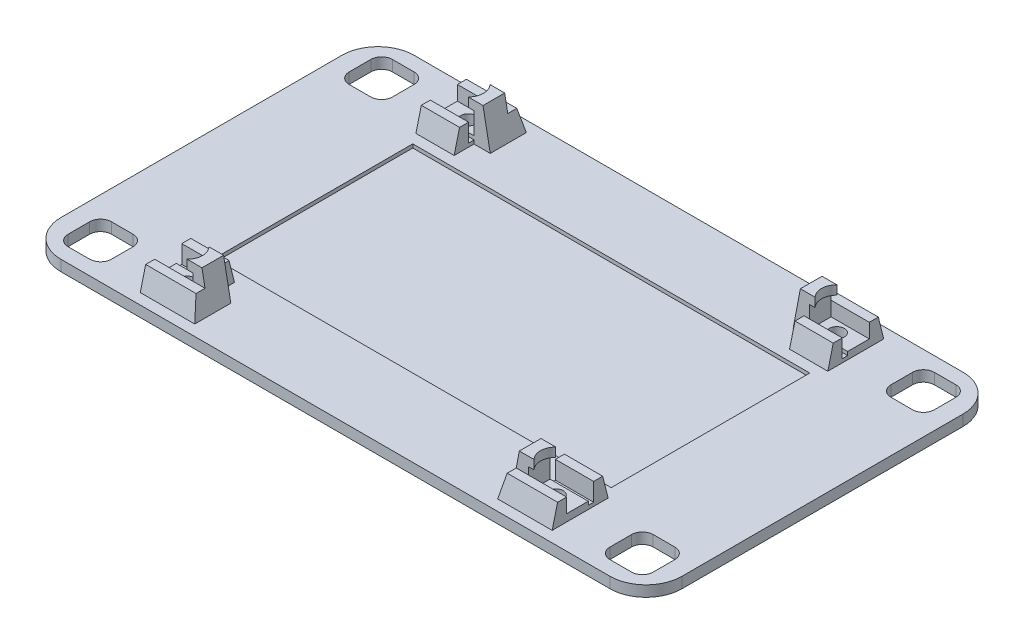
from build123d import *

# Parameters (mm, degrees)
SKETCH1_W                        = 34.5
SKETCH1_H                        = 8.741142107
BOSS_EXTRUDE3_DEPTH              = 3
SKETCH6_W                        = 11
SKETCH6_H                        = 11
BOSS_EXTRUDE4_DEPTH              = 2
CUT_EXTRUDE1_START               = -3
CUT_EXTRUDE1_DEPTH               = 24
SKETCH7_W                        = 11
SKETCH7_H                        = 2.5
SKETCH7_H_2                      = 1
BOSS_EXTRUDE5_DEPTH              = 4
SKETCH10_W                       = 3.083691557
SKETCH10_H                       = 13.597950321
CUT_EXTRUDE2_DEPTH               = 12
SKETCH11_W                       = 10.179154034
SKETCH11_H                       = 1.5
BOSS_EXTRUDE7_DEPTH              = 6
SKETCH12_W                       = 2.5
SKETCH12_H                       = 12.5
BOSS_EXTRUDE8_DEPTH              = 6
BOSS_EXTRUDE9_DEPTH              = 11.6
SKETCH21_R                       = 4
CUT_EXTRUDE9_DEPTH               = 2
CUT_EXTRUDE11_DEPTH              = 11.5
BOSS_EXTRUDE14_DEPTH             = 3
CUT_EXTRUDE12_START              = -1
SKETCH28_W                       = 13.111544153
SKETCH28_H                       = 1.5
CUT_EXTRUDE12_DEPTH              = 11
BOSS_EXTRUDE15_DEPTH             = 1.5
SKETCH30_W                       = 2.5
SKETCH30_H                       = 6
BOSS_EXTRUDE16_DEPTH             = 2
SKETCH31_W                       = 2.5
SKETCH31_H                       = 6
BOSS_EXTRUDE17_DEPTH             = 2.5
BOSS_EXTRUDE18_REACH             = 127.693
BOSS_EXTRUDE18_DIRECTION_2_REACH = 127.693
SKETCH34_W                       = 17.603907028
SKETCH34_H                       = 5.411961877
SKETCH34_H_2                     = 6.558600434
CUT_EXTRUDE13_DEPTH              = 4.5
BOSS_EXTRUDE20_DEPTH             = 11.6
MIRROR11_OUTLINE_R               = 2.069860115
MIRROR11_DEPTH                   = 3
MIRROR11_2_OUTLINE_R             = 4
MIRROR11_2_OUTLINE_R_2           = 2.069860115
MIRROR11_2_DEPTH                 = 2
MIRROR11_START                   = 3
MIRROR11_3_OUTLINE_R             = 2.069860115
MIRROR11_3_DEPTH                 = 2
MIRROR11_4_OUTLINE_W             = 13.1
MIRROR11_4_OUTLINE_H             = 1.5
MIRROR11_4_DEPTH                 = 1
MIRROR11_START_2                 = 5
MIRROR11_5_DEPTH                 = 4
MIRROR11_START_3                 = 11
MIRROR11_6_DEPTH                 = 2.5
MIRROR11_START_4                 = -59.844904725
MIRROR11_7_OUTLINE_W             = 6
MIRROR11_7_OUTLINE_H             = 2.5
MIRROR11_7_DEPTH                 = 15.1
MIRROR11_START_5                 = -49.244904725
MIRROR11_8_OUTLINE_W             = 10.5
MIRROR11_8_OUTLINE_H             = 6
MIRROR11_8_DEPTH                 = 4.5
MIRROR11_START_6                 = -46.744904725
MIRROR11_9_OUTLINE_W             = 6
MIRROR11_9_OUTLINE_H             = 1.5
MIRROR11_9_DEPTH                 = 2
MIRROR11_10_DEPTH                = 1.5
MIRROR11_START_7                 = -43.393309239
MIRROR11_11_DEPTH                = 3.393309239
BOSS_EXTRUDE21_DEPTH             = 11.6
CUT_EXTRUDE14_START              = -5
SKETCH37_W                       = 89.881860183
SKETCH37_H                       = 1.5
SKETCH37_W_2                     = 87.938782422
CUT_EXTRUDE14_DEPTH              = 5
SKETCH39_W                       = 7.636808492
SKETCH39_H                       = 7.005250269
CUT_EXTRUDE18_DEPTH              = 6
MIRROR13_COPY_1_SKETCH_W         = 7.636808492
MIRROR13_COPY_1_SKETCH_H         = 7.005250269
MIRROR13_COPY_1_DEPTH            = 6
SKETCH38_W                       = 110
SKETCH38_H                       = 55
CUT_EXTRUDE19_DEPTH              = 1


with BuildPart() as part:
    # Sketch1 → Boss-Extrude3 (new body)
    # profile 1 of 11: a face of its own
    with BuildSketch(Plane(origin=(0, 0, 0), x_dir=(1, 0, 0), z_dir=(0, 1, 0))):
        with BuildLine():
            Line((73.923306644, 42.779769086), (-59.063365063, 42.779769086))
            ThreePointArc((-59.063365063, 42.779769086), (-65.244285922, 40.219547838), (-67.804507169, 34.03862698))
            Line((-67.804507169, 34.03862698), (-67.804507169, -34.03862698))
            ThreePointArc((-67.804507169, -34.03862698), (-65.244285922, -40.219547838), (-59.063365063, -42.779769086))
            Line((-59.063365063, -42.779769086), (73.923306644, -42.779769086))
            ThreePointArc((73.923306644, -42.779769086), (80.104227503, -40.219547838), (82.664448751, -34.03862698))
            Line((82.664448751, -34.03862698), (82.664448751, 34.03862698))
            ThreePointArc((82.664448751, 34.03862698), (80.104227503, 40.219547838), (73.923306644, 42.779769086))
        make_face()
        with Locations((61.043877697, 34.03862698)):
            Rectangle(SKETCH1_W, SKETCH1_H, mode=Mode.SUBTRACT)
    # profile 2 of 11: a face of its own
    with BuildSketch(Plane(origin=(0, 0, 0), x_dir=(1, 0, 0), z_dir=(0, 1, 0))):
        with BuildLine():
            Line((78.293877697, 29.668055926), (78.293877697, 34.03862698))
            Line((78.293877697, 34.03862698), (74.273170351, 34.03862698))
            ThreePointArc((74.273170351, 34.03862698), (72.293877697, 32.059334326), (70.314585044, 34.03862698))
            Line((70.314585044, 34.03862698), (50.363737812, 34.03862698))
            ThreePointArc((50.363737812, 34.03862698), (48.293877697, 31.968766864), (46.224017582, 34.03862698))
            Line((46.224017582, 34.03862698), (43.793877697, 34.03862698))
            Line((43.793877697, 34.03862698), (43.793877697, 29.668055926))
            Line((43.793877697, 29.668055926), (78.293877697, 29.668055926))
        make_face()
    # profile 3 of 11: a face of its own
    with BuildSketch(Plane(origin=(0, 0, 0), x_dir=(1, 0, 0), z_dir=(0, 1, 0))):
        with BuildLine():
            Line((78.293877697, 34.03862698), (78.293877697, 38.409198033))
            Line((78.293877697, 38.409198033), (43.793877697, 38.409198033))
            Line((43.793877697, 38.409198033), (43.793877697, 34.03862698))
            Line((43.793877697, 34.03862698), (46.224017582, 34.03862698))
            ThreePointArc((46.224017582, 34.03862698), (48.293877697, 36.108487095), (50.363737812, 34.03862698))
            Line((50.363737812, 34.03862698), (70.314585044, 34.03862698))
            ThreePointArc((70.314585044, 34.03862698), (72.293877697, 36.017919633), (74.273170351, 34.03862698))
            Line((74.273170351, 34.03862698), (78.293877697, 34.03862698))
        make_face()
    # profile 4 of 11: a face of its own
    with BuildSketch(Plane(origin=(0, 0, 0), x_dir=(1, 0, 0), z_dir=(0, 1, 0))):
        with BuildLine():
            ThreePointArc((70.314585044, 34.03862698), (72.293877697, 32.059334326), (74.273170351, 34.03862698))
            Line((74.273170351, 34.03862698), (70.314585044, 34.03862698))
        make_face()
    # profile 5 of 11: a face of its own
    with BuildSketch(Plane(origin=(0, 0, 0), x_dir=(1, 0, 0), z_dir=(0, 1, 0))):
        with BuildLine():
            Line((70.314585044, 34.03862698), (74.273170351, 34.03862698))
            ThreePointArc((74.273170351, 34.03862698), (72.293877697, 36.017919633), (70.314585044, 34.03862698))
        make_face()
    # profile 6 of 11: a face of its own
    with BuildSketch(Plane(origin=(0, 0, 0), x_dir=(1, 0, 0), z_dir=(0, 1, 0))):
        with BuildLine():
            ThreePointArc((70.314585044, 34.03862698), (72.293877697, 32.059334326), (74.273170351, 34.03862698))
            Line((74.273170351, 34.03862698), (70.314585044, 34.03862698))
        make_face()
    # profile 7 of 11: a face of its own
    with BuildSketch(Plane(origin=(0, 0, 0), x_dir=(1, 0, 0), z_dir=(0, 1, 0))):
        with BuildLine():
            Line((70.314585044, 34.03862698), (74.273170351, 34.03862698))
            ThreePointArc((74.273170351, 34.03862698), (72.293877697, 36.017919633), (70.314585044, 34.03862698))
        make_face()
    # profile 8 of 11: a face of its own
    with BuildSketch(Plane(origin=(0, 0, 0), x_dir=(1, 0, 0), z_dir=(0, 1, 0))):
        with BuildLine():
            ThreePointArc((50.363737812, 34.03862698), (48.293877697, 36.108487095), (46.224017582, 34.03862698))
            Line((46.224017582, 34.03862698), (50.363737812, 34.03862698))
        make_face()
    # profile 9 of 11: a face of its own
    with BuildSketch(Plane(origin=(0, 0, 0), x_dir=(1, 0, 0), z_dir=(0, 1, 0))):
        with BuildLine():
            Line((50.363737812, 34.03862698), (46.224017582, 34.03862698))
            ThreePointArc((46.224017582, 34.03862698), (48.293877697, 31.968766864), (50.363737812, 34.03862698))
        make_face()
    # profile 10 of 11: a face of its own
    with BuildSketch(Plane(origin=(0, 0, 0), x_dir=(1, 0, 0), z_dir=(0, 1, 0))):
        with BuildLine():
            ThreePointArc((50.363737812, 34.03862698), (48.293877697, 36.108487095), (46.224017582, 34.03862698))
            Line((46.224017582, 34.03862698), (50.363737812, 34.03862698))
        make_face()
    # profile 11 of 11: a face of its own
    with BuildSketch(Plane(origin=(0, 0, 0), x_dir=(1, 0, 0), z_dir=(0, 1, 0))):
        with BuildLine():
            Line((50.363737812, 34.03862698), (46.224017582, 34.03862698))
            ThreePointArc((46.224017582, 34.03862698), (48.293877697, 31.968766864), (50.363737812, 34.03862698))
        make_face()
    extrude(amount=BOSS_EXTRUDE3_DEPTH)

    # Sketch6 → Boss-Extrude4 (add)
    with BuildSketch(Plane(origin=(0, 3, 0), x_dir=(1, 0, 0), z_dir=(0, 1, 0))):
        with Locations((48.114723663, 34.03862698)):
            Rectangle(SKETCH6_W, SKETCH6_H)
    boss_extrude4 = extrude(amount=BOSS_EXTRUDE4_DEPTH)

    # Sketch1<5> → Cut-Extrude1 (cut)
    with BuildSketch(Plane(origin=(0, 0, 0), x_dir=(1, 0, 0), z_dir=(0, 1, 0)).offset(CUT_EXTRUDE1_START)):
        with BuildLine():
            ThreePointArc((50.363737812, 34.03862698), (48.293877697, 36.108487095), (46.224017582, 34.03862698))
            Line((46.224017582, 34.03862698), (50.363737812, 34.03862698))
        make_face()
        with BuildLine():
            Line((50.363737812, 34.03862698), (46.224017582, 34.03862698))
            ThreePointArc((46.224017582, 34.03862698), (48.293877697, 31.968766864), (50.363737812, 34.03862698))
        make_face()
    cut_extrude1 = extrude(amount=CUT_EXTRUDE1_DEPTH, mode=Mode.SUBTRACT)

    # Sketch7 → Boss-Extrude5 (add)
    with BuildSketch(Plane(origin=(0, 5, 0), x_dir=(1, 0, 0), z_dir=(0, 1, 0))):
        with Locations((48.114723663, 38.28862698)):
            Rectangle(SKETCH7_W, SKETCH7_H)
        with Locations((48.114723663, 29.03862698)):
            Rectangle(SKETCH7_W, SKETCH7_H_2)
    boss_extrude5 = extrude(amount=BOSS_EXTRUDE5_DEPTH)

    # Sketch10 → Cut-Extrude2 (cut)
    with BuildSketch(Plane(origin=(0, 3, 0), x_dir=(1, 0, 0), z_dir=(0, 1, 0))):
        with Locations((54.335723476, 34.069991953)):
            Rectangle(SKETCH10_W, SKETCH10_H)
    cut_extrude2 = extrude(amount=CUT_EXTRUDE2_DEPTH, mode=Mode.SUBTRACT)

    # Sketch11 → Boss-Extrude7 (add)
    with BuildSketch(Plane(origin=(0, 3, 0), x_dir=(1, 0, 0), z_dir=(0, 1, 0))):
        with Locations((47.70430068, 27.78862698)):
            Rectangle(SKETCH11_W, SKETCH11_H)
    boss_extrude7 = extrude(amount=BOSS_EXTRUDE7_DEPTH)

    # Sketch12 → Boss-Extrude8 (add)
    with BuildSketch(Plane(origin=(0, 3, 0), x_dir=(1, 0, 0), z_dir=(0, 1, 0))):
        with Locations((42.443877697, 33.28862698)):
            Rectangle(SKETCH12_W, SKETCH12_H)
    boss_extrude8 = extrude(amount=BOSS_EXTRUDE8_DEPTH)

    # Sketch13 → Boss-Extrude9 (add)
    with BuildSketch(Plane.ZY.offset(-41.193877697)):
        Polygon((-27.03862698, 9), (-27.03862698, 3), (-25.53862698, 3), align=None)
        Polygon((-39.53862698, 9), (-39.53862698, 3), (-41.03862698, 3), align=None)
    extrude(amount=-BOSS_EXTRUDE9_DEPTH)

    # Sketch21 → Cut-Extrude9 (cut)
    with BuildSketch(Plane.XZ):
        with Locations(Location((48.293877697, -34.03862698, 0), (0, 0, 270))):
            Circle(SKETCH21_R)
    cut_extrude9 = extrude(amount=-CUT_EXTRUDE9_DEPTH, mode=Mode.SUBTRACT)

    # Sketch24 → Cut-Extrude11 (cut)
    with BuildSketch(Plane(origin=(0, 3, 0), x_dir=(1, 0, 0), z_dir=(0, 1, 0))):
        with BuildLine():
            Line((69.293877697, 40.03862698), (75.293877697, 40.03862698))
            ThreePointArc((75.293877697, 40.03862698), (77.415198041, 39.159947323), (78.293877697, 37.03862698))
            Line((78.293877697, 37.03862698), (78.293877697, 31.03862698))
            ThreePointArc((78.293877697, 31.03862698), (77.415198041, 28.917306636), (75.293877697, 28.03862698))
            Line((75.293877697, 28.03862698), (69.293877697, 28.03862698))
            ThreePointArc((69.293877697, 28.03862698), (67.172557354, 28.917306636), (66.293877697, 31.03862698))
            Line((66.293877697, 31.03862698), (66.293877697, 37.03862698))
            ThreePointArc((66.293877697, 37.03862698), (67.172557354, 39.159947323), (69.293877697, 40.03862698))
        make_face()
    cut_extrude11 = extrude(amount=-CUT_EXTRUDE11_DEPTH, mode=Mode.SUBTRACT)

    # Sketch26 → Boss-Extrude14 (add)
    with BuildSketch(Plane.XZ):
        with BuildLine():
            Line((-78.844904725, 53.842790723), (73.293877697, 53.842790723))
            ThreePointArc((73.293877697, 53.842790723), (80.364945509, 50.913858534), (83.293877697, 43.842790723))
            Line((83.293877697, 43.842790723), (83.293877697, -34.03862698))
            ThreePointArc((83.293877697, -34.03862698), (80.364945509, -41.109694791), (73.293877697, -44.03862698))
            Line((73.293877697, -44.03862698), (-78.844904725, -44.03862698))
            ThreePointArc((-78.844904725, -44.03862698), (-85.915972537, -41.109694791), (-88.844904725, -34.03862698))
            Line((-88.844904725, -34.03862698), (-88.844904725, 43.842790723))
            ThreePointArc((-88.844904725, 43.842790723), (-85.915972537, 50.913858534), (-78.844904725, 53.842790723))
        make_face()
        Polygon((39.621658068, -22.50744652), (81.471959084, -23.594467326), (79.917902441, -39.014138958), (77.090986998, -41.323408937), (59.598365076, -40.869055121), (39.621658068, -40.350179614), align=None, mode=Mode.SUBTRACT)
    extrude(amount=-BOSS_EXTRUDE14_DEPTH)

    # Sketch28 → Cut-Extrude12 (cut)
    with BuildSketch(Plane(origin=(0, 5, 0), x_dir=(1, 0, 0), z_dir=(0, 1, 0)).offset(CUT_EXTRUDE12_START)):
        with Locations((46.238105621, 30.28862698)):
            Rectangle(SKETCH28_W, SKETCH28_H)
    cut_extrude12 = extrude(amount=CUT_EXTRUDE12_DEPTH, mode=Mode.SUBTRACT)

    # Sketch29 → Boss-Extrude15 (add)
    with BuildSketch(Plane(origin=(52.793877697, 0, 0), x_dir=(0, 0, -1), z_dir=(1, 0, 0))):
        Polygon((37.03862698, 5), (31.03862698, 5), (31.03862698, 4), (29.53862698, 4), (29.53862698, 9), (27.03862698, 9), (25.53862698, 3), (41.03862698, 3), (39.53862698, 9), (37.03862698, 9), align=None)
    boss_extrude15 = extrude(amount=BOSS_EXTRUDE15_DEPTH)

    # Sketch30 → Boss-Extrude16 (add)
    with BuildSketch(Plane(origin=(0, 9, 0), x_dir=(1, 0, 0), z_dir=(0, 1, 0))):
        with Locations((42.443877697, 34.03862698)):
            Rectangle(SKETCH30_W, SKETCH30_H)
    boss_extrude16 = extrude(amount=BOSS_EXTRUDE16_DEPTH)

    # Sketch31 → Boss-Extrude17 (add)
    with BuildSketch(Plane(origin=(0, 11, 0), x_dir=(1, 0, 0), z_dir=(0, 1, 0))):
        with Locations((42.443877697, 34.03862698)):
            Rectangle(SKETCH31_W, SKETCH31_H)
        with BuildLine():
            Line((45.283479053, 37.03862698), (43.693877697, 37.03862698))
            Line((43.693877697, 37.03862698), (43.693877697, 31.03862698))
            Line((43.693877697, 31.03862698), (45.283479053, 31.03862698))
            ThreePointArc((45.283479053, 31.03862698), (44.043877697, 34.03862698), (45.283479053, 37.03862698))
        make_face()
    boss_extrude17 = extrude(amount=BOSS_EXTRUDE17_DEPTH)

    # Boss-Extrude18: up to this plane
    boss_extrude18_end = Plane(origin=(58.978536136, 3, -25.53862698), z_dir=(0, 0.24253562503633314, 0.9701425001453319))
    # Sketch33 → Boss-Extrude18 (add, up to the surface)
    with BuildSketch(Plane.XY.offset(-34.03862698), mode=Mode.PRIVATE) as boss_extrude18_sk1:
        Polygon((41.193877697, 13.5), (39.193877697, 3), (41.193877697, 3), align=None)
    boss_extrude18_tool1 = split(extrude(boss_extrude18_sk1.sketch, amount=BOSS_EXTRUDE18_REACH, mode=Mode.PRIVATE), bisect_by=boss_extrude18_end, keep=Keep.BOTH, mode=Mode.PRIVATE)
    boss_extrude18 = boss_extrude18_tool1.solids().sort_by_distance((40.527211, 6.5, -34.038627))[0]
    add(boss_extrude18)

    # Boss-Extrude18 direction 2: up to this plane
    boss_extrude18_direction_2_end = Plane(origin=(58.978536136, 3, -41.03862698), z_dir=(0, 0.24253562503633314, -0.9701425001453319))
    # Sketch33 → Boss-Extrude18 direction 2 (add, up to the surface)
    with BuildSketch(Plane.XY.offset(-34.03862698), mode=Mode.PRIVATE) as boss_extrude18_direction_2_sk1:
        Polygon((41.193877697, 13.5), (39.193877697, 3), (41.193877697, 3), align=None)
    boss_extrude18_direction_2_tool1 = split(extrude(boss_extrude18_direction_2_sk1.sketch, amount=-BOSS_EXTRUDE18_DIRECTION_2_REACH, mode=Mode.PRIVATE), bisect_by=boss_extrude18_direction_2_end, keep=Keep.BOTH, mode=Mode.PRIVATE)
    boss_extrude18_direction_2 = boss_extrude18_direction_2_tool1.solids().sort_by_distance((40.527211, 6.5, -34.038627))[0]
    add(boss_extrude18_direction_2)
    boss_extrude18 = boss_extrude18 + boss_extrude18_direction_2  # both directions under the feature's name, for the pattern or mirror that repeats it

    # Sketch34 → Cut-Extrude13 (cut)
    with BuildSketch(Plane(origin=(0, 13.5, 0), x_dir=(1, 0, 0), z_dir=(0, 1, 0))):
        with Locations((45.491924183, 39.744607919)):
            Rectangle(SKETCH34_W, SKETCH34_H)
        with Locations((45.491924183, 27.759326763)):
            Rectangle(SKETCH34_W, SKETCH34_H_2)
    cut_extrude13 = extrude(amount=-CUT_EXTRUDE13_DEPTH, mode=Mode.SUBTRACT)

    # Mirror9: Boss-Extrude4, Cut-Extrude1, Boss-Extrude5, Cut-Extrude2, Boss-Extrude7, Boss-Extrude8, Cut-Extrude9, Cut-Extrude11, Cut-Extrude12, Boss-Extrude15, Boss-Extrude16, Boss-Extrude17, Boss-Extrude18, Cut-Extrude13 across plane
    add(boss_extrude4.mirror(Plane.XY.offset(4.902081871)))
    add(cut_extrude1.mirror(Plane.XY.offset(4.902081871)), mode=Mode.SUBTRACT)
    add(boss_extrude5.mirror(Plane.XY.offset(4.902081871)))
    add(cut_extrude2.mirror(Plane.XY.offset(4.902081871)), mode=Mode.SUBTRACT)
    add(boss_extrude7.mirror(Plane.XY.offset(4.902081871)))
    add(boss_extrude8.mirror(Plane.XY.offset(4.902081871)))
    add(cut_extrude9.mirror(Plane.XY.offset(4.902081871)), mode=Mode.SUBTRACT)
    add(cut_extrude11.mirror(Plane.XY.offset(4.902081871)), mode=Mode.SUBTRACT)
    add(cut_extrude12.mirror(Plane.XY.offset(4.902081871)), mode=Mode.SUBTRACT)
    add(boss_extrude15.mirror(Plane.XY.offset(4.902081871)))
    add(boss_extrude16.mirror(Plane.XY.offset(4.902081871)))
    add(boss_extrude17.mirror(Plane.XY.offset(4.902081871)))
    add(boss_extrude18.mirror(Plane.XY.offset(4.902081871)))
    add(cut_extrude13.mirror(Plane.XY.offset(4.902081871)), mode=Mode.SUBTRACT)

    # Sketch35 → Boss-Extrude20 (add)
    with BuildSketch(Plane.ZY.offset(-52.793877697)):
        Polygon((35.342790723, 3), (36.842790723, 3), (36.842790723, 9), align=None)
        Polygon((50.842790723, 3), (49.342790723, 9), (49.342790723, 3), align=None)
    extrude(amount=BOSS_EXTRUDE20_DEPTH)

    # Mirror11: read off the stored shape, not the designer's step
    # Mirror11 outline → Mirror11 (cut)
    with BuildSketch(Plane(origin=(0, 0, 0), x_dir=(1, 0, 0), z_dir=(0, 1, 0))):
        with Locations((-53.844904725, 34.03862698)):
            Circle(MIRROR11_OUTLINE_R)
        with Locations((-53.844904725, -43.842790723)):
            Circle(MIRROR11_OUTLINE_R)
        with BuildLine():
            Line((-74.844904725, 40.03862698), (-80.844904725, 40.03862698))
            ThreePointArc((-80.844904725, 40.03862698), (-82.966225069, 39.159947323), (-83.844904725, 37.03862698))
            Line((-83.844904725, 37.03862698), (-83.844904725, 31.03862698))
            ThreePointArc((-83.844904725, 31.03862698), (-82.966225069, 28.917306636), (-80.844904725, 28.03862698))
            Line((-80.844904725, 28.03862698), (-74.844904725, 28.03862698))
            ThreePointArc((-74.844904725, 28.03862698), (-72.723584382, 28.917306636), (-71.844904725, 31.03862698))
            Line((-71.844904725, 31.03862698), (-71.844904725, 37.03862698))
            ThreePointArc((-71.844904725, 37.03862698), (-72.723584382, 39.159947323), (-74.844904725, 40.03862698))
        make_face()
        with BuildLine():
            ThreePointArc((-71.844904725, -40.842790723), (-72.723584382, -38.721470379), (-74.844904725, -37.842790723))
            Line((-74.844904725, -37.842790723), (-80.844904725, -37.842790723))
            ThreePointArc((-80.844904725, -37.842790723), (-82.966225069, -38.721470379), (-83.844904725, -40.842790723))
            Line((-83.844904725, -40.842790723), (-83.844904725, -46.842790723))
            ThreePointArc((-83.844904725, -46.842790723), (-82.966225069, -48.964111066), (-80.844904725, -49.842790723))
            Line((-80.844904725, -49.842790723), (-74.844904725, -49.842790723))
            ThreePointArc((-74.844904725, -49.842790723), (-72.723584382, -48.964111066), (-71.844904725, -46.842790723))
            Line((-71.844904725, -46.842790723), (-71.844904725, -40.842790723))
        make_face()
    extrude(amount=MIRROR11_DEPTH, mode=Mode.SUBTRACT)

    # Mirror11 2 outline → Mirror11 2 (cut)
    # profile 1 of 2: a face of its own
    with BuildSketch(Plane(origin=(0, 0, 0), x_dir=(1, 0, 0), z_dir=(0, 1, 0))):
        with Locations((-53.844904725, -43.842790723)):
            Circle(MIRROR11_2_OUTLINE_R)
        with Locations((-53.844904725, -43.842790723)):
            Circle(MIRROR11_2_OUTLINE_R_2, mode=Mode.SUBTRACT)
    # profile 2 of 2: a face of its own
    with BuildSketch(Plane(origin=(0, 0, 0), x_dir=(1, 0, 0), z_dir=(0, 1, 0))):
        with Locations((-53.844904725, 34.03862698)):
            Circle(MIRROR11_2_OUTLINE_R)
        with Locations((-53.844904725, 34.03862698)):
            Circle(MIRROR11_2_OUTLINE_R_2, mode=Mode.SUBTRACT)
    extrude(amount=MIRROR11_2_DEPTH, mode=Mode.SUBTRACT)

    # Mirror11 3 outline → Mirror11 3 (add)
    # profile 1 of 2: a face of its own
    with BuildSketch(Plane(origin=(0, 0, 0), x_dir=(1, 0, 0), z_dir=(0, 1, 0)).offset(MIRROR11_START)):
        with BuildLine():
            Line((-49.244904725, -46.842790723), (-49.244904725, -40.842790723))
            Line((-49.244904725, -40.842790723), (-59.844904725, -40.842790723))
            Line((-59.844904725, -40.842790723), (-59.844904725, -46.842790723))
            Line((-59.844904725, -46.842790723), (-56.490656036, -46.842790723))
            ThreePointArc((-56.490656036, -46.842790723), (-53.844904725, -47.842790723), (-51.199153414, -46.842790723))
            Line((-51.199153414, -46.842790723), (-49.244904725, -46.842790723))
        make_face()
        with Locations((-53.844904725, -43.842790723)):
            Circle(MIRROR11_3_OUTLINE_R, mode=Mode.SUBTRACT)
    # profile 2 of 2: a face of its own
    with BuildSketch(Plane(origin=(0, 0, 0), x_dir=(1, 0, 0), z_dir=(0, 1, 0)).offset(MIRROR11_START)):
        with BuildLine():
            Line((-49.244904725, 31.03862698), (-49.244904725, 37.03862698))
            Line((-49.244904725, 37.03862698), (-51.199153414, 37.03862698))
            ThreePointArc((-51.199153414, 37.03862698), (-53.844904725, 38.03862698), (-56.490656036, 37.03862698))
            Line((-56.490656036, 37.03862698), (-59.844904725, 37.03862698))
            Line((-59.844904725, 37.03862698), (-59.844904725, 31.03862698))
            Line((-59.844904725, 31.03862698), (-49.244904725, 31.03862698))
        make_face()
        with Locations((-53.844904725, 34.03862698)):
            Circle(MIRROR11_3_OUTLINE_R, mode=Mode.SUBTRACT)
    extrude(amount=MIRROR11_3_DEPTH)

    # Mirror11 4 outline → Mirror11 4 (add)
    with BuildSketch(Plane(origin=(0, 0, 0), x_dir=(1, 0, 0), z_dir=(0, 1, 0)).offset(MIRROR11_START)):
        with Locations((-53.294904725, -40.092790723)):
            Rectangle(MIRROR11_4_OUTLINE_W, MIRROR11_4_OUTLINE_H)
        with Locations((-53.294904725, 30.28862698)):
            Rectangle(MIRROR11_4_OUTLINE_W, MIRROR11_4_OUTLINE_H)
    extrude(amount=MIRROR11_4_DEPTH)

    # Mirror11 5 outline → Mirror11 5 (add)
    with BuildSketch(Plane(origin=(0, 0, 0), x_dir=(1, 0, 0), z_dir=(0, 1, 0)).offset(MIRROR11_START_2)):
        with BuildLine():
            ThreePointArc((-56.490656036, -46.842790723), (-53.844904725, -47.842790723), (-51.199153414, -46.842790723))
            Line((-51.199153414, -46.842790723), (-56.490656036, -46.842790723))
        make_face()
        with BuildLine():
            Line((-56.490656036, 37.03862698), (-51.199153414, 37.03862698))
            ThreePointArc((-51.199153414, 37.03862698), (-53.844904725, 38.03862698), (-56.490656036, 37.03862698))
        make_face()
    extrude(amount=MIRROR11_5_DEPTH)

    # Mirror11 7 outline → Mirror11 7 (add)
    with BuildSketch(Plane.YZ.offset(MIRROR11_START_4)):
        Polygon((3, 39.342790723), (3, 35.342790723), (9, 36.842790723), (9, 39.342790723), align=None)
        with Locations((6, -28.28862698)):
            Rectangle(MIRROR11_7_OUTLINE_W, MIRROR11_7_OUTLINE_H)
        with Locations((6, -38.28862698)):
            Rectangle(MIRROR11_7_OUTLINE_W, MIRROR11_7_OUTLINE_H)
        Polygon((3, 50.842790723), (3, 46.842790723), (9, 46.842790723), (9, 49.342790723), align=None)
    extrude(amount=MIRROR11_7_DEPTH)



with BuildPart() as body_2:
    # Mirror11 6 outline → Mirror11 6 (new body)
    with BuildSketch(Plane(origin=(0, 0, 0), x_dir=(1, 0, 0), z_dir=(0, 1, 0)).offset(MIRROR11_START_3)):
        with BuildLine():
            Line((-50.834506081, -46.842790723), (-49.244904725, -46.842790723))
            Line((-49.244904725, -46.842790723), (-49.244904725, -40.842790723))
            Line((-49.244904725, -40.842790723), (-50.834506081, -40.842790723))
            ThreePointArc((-50.834506081, -40.842790723), (-49.594904725, -43.842790723), (-50.834506081, -46.842790723))
        make_face()
        with BuildLine():
            Line((-49.244904725, 31.03862698), (-49.244904725, 37.03862698))
            Line((-49.244904725, 37.03862698), (-50.834506081, 37.03862698))
            ThreePointArc((-50.834506081, 37.03862698), (-49.594904725, 34.03862698), (-50.834506081, 31.03862698))
            Line((-50.834506081, 31.03862698), (-49.244904725, 31.03862698))
        make_face()
    extrude(amount=MIRROR11_6_DEPTH)


with BuildPart() as part_1:
    add(part.part)

    add(body_2.part)  # Mirror11 8 merges body 2
    # Mirror11 8 outline → Mirror11 8 (add)
    with BuildSketch(Plane.YZ.offset(MIRROR11_START_5)):
        with Locations((8.25, -34.03862698)):
            Rectangle(MIRROR11_8_OUTLINE_W, MIRROR11_8_OUTLINE_H)
        with Locations((8.25, 43.842790723)):
            Rectangle(MIRROR11_8_OUTLINE_W, MIRROR11_8_OUTLINE_H)
    extrude(amount=MIRROR11_8_DEPTH)

    # Mirror11 9 outline → Mirror11 9 (add)
    with BuildSketch(Plane.YZ.offset(MIRROR11_START_6)):
        with Locations((6, -30.28862698)):
            Rectangle(MIRROR11_9_OUTLINE_W, MIRROR11_9_OUTLINE_H)
        Polygon((3, -27.03862698), (9, -27.03862698), (3, -25.53862698), align=None)
        with Locations((6, 40.092790723)):
            Rectangle(MIRROR11_9_OUTLINE_W, MIRROR11_9_OUTLINE_H)
        Polygon((9, -39.53862698), (3, -39.53862698), (3, -41.03862698), align=None)
    extrude(amount=MIRROR11_9_DEPTH)

    # Mirror11 10 outline → Mirror11 10 (add)
    with BuildSketch(Plane.YZ.offset(MIRROR11_START_4)):
        Polygon((3, -27.03862698), (9, -27.03862698), (3, -25.53862698), align=None)
        Polygon((9, -39.53862698), (3, -39.53862698), (3, -41.03862698), align=None)
    extrude(amount=MIRROR11_10_DEPTH)

    # Mirror11 11 outline → Mirror11 11 (cut)
    with BuildSketch(Plane(origin=(0, 0, 0), x_dir=(-0.18711210788999502, 0.9823385664224749, 0), z_dir=(0.9823385664224749, 0.187112107889995, 0)).offset(MIRROR11_START_7)):
        Polygon((11.31932914, -41.03862698), (17.427202947, -39.53862698), (17.427202947, -37.03862698), (22.008108303, -37.03862698), (22.008108303, -31.03862698), (17.427202947, -31.03862698), (17.427202947, -27.03862698), (11.31932914, -25.53862698), align=None)
        Polygon((22.008108303, 40.842790723), (22.008108303, 46.842790723), (17.427202947, 46.842790723), (17.427202947, 49.342790723), (11.31932914, 50.842790723), (11.31932914, 35.342790723), (17.427202947, 36.842790723), (17.427202947, 40.842790723), align=None)
    extrude(amount=MIRROR11_11_DEPTH, mode=Mode.SUBTRACT)

    # Sketch36 → Boss-Extrude21 (add)
    with BuildSketch(Plane(origin=(-58.344904725, 0, 0), x_dir=(0, 0, -1), z_dir=(1, 0, 0))):
        Polygon((41.03862698, 3), (39.53862698, 9), (39.53862698, 3), align=None)
        Polygon((25.53862698, 3), (27.03862698, 3), (27.03862698, 9), align=None)
    extrude(amount=BOSS_EXTRUDE21_DEPTH)

    # Sketch37 → Cut-Extrude14 (cut)
    with BuildSketch(Plane(origin=(0, 9, 0), x_dir=(1, 0, 0), z_dir=(0, 1, 0)).offset(CUT_EXTRUDE14_START)):
        with Locations((-3.747052394, -40.092790723)):
            Rectangle(SKETCH37_W, SKETCH37_H)
        with Locations((-2.775513514, 30.28862698)):
            Rectangle(SKETCH37_W_2, SKETCH37_H)
    extrude(amount=CUT_EXTRUDE14_DEPTH, mode=Mode.SUBTRACT)

    # Sketch39 → Cut-Extrude18 (cut)
    with BuildSketch(Plane(origin=(0, 9, 0), x_dir=(1, 0, 0), z_dir=(0, 1, 0))):
        with Locations((-45.426500479, -37.340165588)):
            Rectangle(SKETCH39_W, SKETCH39_H)
    cut_extrude18 = extrude(amount=-CUT_EXTRUDE18_DEPTH, mode=Mode.SUBTRACT)

    # Mirror12: Cut-Extrude18 across plane
    add(cut_extrude18.mirror(Plane.XY.offset(4.902081871)), mode=Mode.SUBTRACT)

    # Mirror13: Cut-Extrude18 across plane
    add(cut_extrude18.mirror(Plane.ZY.offset(2.775513514)), mode=Mode.SUBTRACT)

    # Mirror13 copy 1 sketch → Mirror13 copy 1 (cut)
    with BuildSketch(Plane(origin=(-5.551027028, 9, 9.804163743), x_dir=(-1, 0, 0), z_dir=(0, 1, 0))):
        with Locations((-45.426500479, -37.340165588)):
            Rectangle(MIRROR13_COPY_1_SKETCH_W, MIRROR13_COPY_1_SKETCH_H)
    extrude(amount=-MIRROR13_COPY_1_DEPTH, mode=Mode.SUBTRACT)

    # Sketch38 → Cut-Extrude19 (cut)
    with BuildSketch(Plane(origin=(0, 3, 0), x_dir=(1, 0, 0), z_dir=(0, 1, 0))):
        with Locations((-2.775513514, -4.902081871)):
            Rectangle(SKETCH38_W, SKETCH38_H)
    extrude(amount=-CUT_EXTRUDE19_DEPTH, mode=Mode.SUBTRACT)


solid = part_1.part
